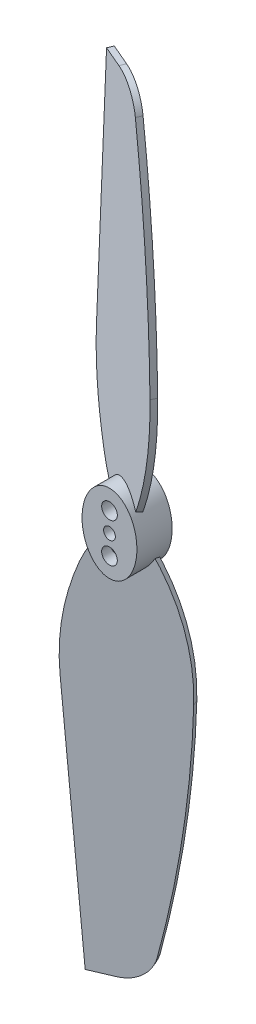
from build123d import *

# Parameters (mm, degrees)
BASE_CYL_DEPTH      = 4.5
PROPELLER_1_DEPTH   = 0.375
FLIP_ROTATION_ANGLE = 46.397181
SKETCH6_R           = 0.75
SKETCH6_R_2         = 1
HOLES_DEPTH         = 51.672574183


with BuildPart() as part:
    # Sketch1 → base cyl (new body)
    with BuildSketch(Plane(origin=(0, 0, 0), x_dir=(0, 1, 0), z_dir=(0, 0, 1))):
        with BuildLine():
            Line((0, 3.5), (0, -3.5))
            add(Edge.make_bspline(
                [(0, -3.5), (5, -3.5), (5, 0), (5, 3.5), (0, 3.5)],
                knots=[1.570796327, 1.570796327, 1.570796327, 3.141592654, 3.141592654, 4.71238898, 4.71238898, 4.71238898], degree=2, weights=[1, 0.707106781, 1, 0.707106781, 1]))
        make_face()
    extrude(amount=BASE_CYL_DEPTH)

    # mirror cyl: part across plane


with BuildPart() as body_2:
    # Sketch3 → propeller 1 (new, symmetric)
    with BuildSketch(Plane(origin=(-0.814655172, 0, 1.900862069), x_dir=(0.9191450300180579, 0, 0.39391929857916774), z_dir=(-0.39391929857916774, 0, 0.919145030018058))):
        with BuildLine():
            Line((-5.613681578, 18), (-3.169992707, 50))
            Line((-3.169992707, 50), (-0.169992707, 50))
            ThreePointArc((-0.169992707, 50), (2.38691804, 49.155307497), (3.830007293, 46.881809881))
            ThreePointArc((3.830007293, 46.881809881), (6.330689995, 32.529872056), (7.386318422, 18))
            ThreePointArc((7.386318422, 18), (6.084481394, 8.557505759), (1.886318422, 0))
            Line((1.886318422, 0), (-0.113681578, 0))
            ThreePointArc((-0.113681578, 0), (-2.2443271, 2.26430716), (-3.721730883, 5))
            ThreePointArc((-3.721730883, 5), (-5.38802994, 11.395167927), (-5.613681578, 18))
        make_face()
    extrude(amount=PROPELLER_1_DEPTH, both=True)


with BuildPart() as body_3:
    # mirror propeller: mirrored copy
    add(body_2.part.mirror(Plane(origin=(-3.5, 0, 4.5), x_dir=(0, 0, 1), z_dir=(0, 1, 0))))


with BuildPart() as body_3_1:
    # flip rotation: moved
    add(body_3.part.rotate(Axis((0.214116178, 0, 1.999751921), (0, 1, 0)), FLIP_ROTATION_ANGLE))


with BuildPart() as part_1:
    add(part.part)
    add(part.part.mirror(Plane(origin=(-3.5, 0, 4.5), x_dir=(0, 0, 1), z_dir=(0, 1, 0))))

    # Sketch6 → holes (cut, through all)
    with BuildSketch(Plane.XY.offset(4.5)):
        Circle(SKETCH6_R)
        with Locations((0, 2.5)):
            Circle(SKETCH6_R_2)
        with Locations((0, -2.5)):
            Circle(SKETCH6_R_2)
    extrude(amount=-HOLES_DEPTH, mode=Mode.SUBTRACT)


solid = Compound([body_2.part, body_3_1.part, part_1.part])
